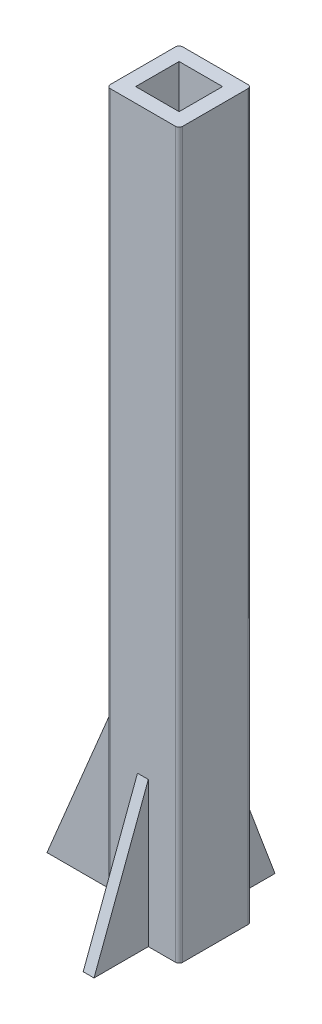
from build123d import *

# Parameters (mm, degrees)
SKETCH1_W           = 24
SKETCH1_H           = 24
BOSS_EXTRUDE1_DEPTH = 400
RIB2_START          = -3
RIB2_DEPTH          = 6
BOSS_EXTRUDE2_DEPTH = 3
SCALE3_SCALE        = 7.5


# Read off the part's stored shape, not the designer's step: Rib2
with BuildPart() as part:
    # Sketch1 → Boss-Extrude1 (new body)
    with BuildSketch(Plane(origin=(0, 0, 0), x_dir=(1, 0, 0), z_dir=(0, 1, 0))):
        with BuildLine():
            Line((2, 0), (38, 0))
            ThreePointArc((38, 0), (39.414213562, 0.585786438), (40, 2))
            Line((40, 2), (40, 38))
            ThreePointArc((40, 38), (39.414213562, 39.414213562), (38, 40))
            Line((38, 40), (2, 40))
            ThreePointArc((2, 40), (0.585786438, 39.414213562), (0, 38))
            Line((0, 38), (0, 2))
            ThreePointArc((0, 2), (0.585786438, 0.585786438), (2, 0))
        make_face()
        with Locations((20, 20)):
            Rectangle(SKETCH1_W, SKETCH1_H, mode=Mode.SUBTRACT)
    extrude(amount=BOSS_EXTRUDE1_DEPTH)

    # Rib2 outline → Rib2 (add)
    with BuildSketch(Plane.ZY.offset(-20).offset(RIB2_START)):
        Polygon((0, 80), (0, 0), (30, 0), align=None)
    rib2 = extrude(amount=RIB2_DEPTH)

    # Mirror1: Rib2 across plane
    add(rib2.mirror(Plane(origin=(0, 0, -20), x_dir=(1, 0, 0), z_dir=(0, 0, -1))))

    # Sketch4 → Boss-Extrude2 (add, symmetric)
    with BuildSketch(Plane(origin=(0, 0, -20), x_dir=(-1, 0, 0), z_dir=(0, 0, -1))):
        Polygon((50, 0), (0, 120), (0, 0), align=None)
    extrude(amount=BOSS_EXTRUDE2_DEPTH, both=True)


with BuildPart() as part_1:
    # Scale3: scaled about (18.502132923, 187.799191807, -20)
    add(part.part.scale(SCALE3_SCALE).moved(Location((-120.263864, -1220.694746745, 130))))


solid = part_1.part
